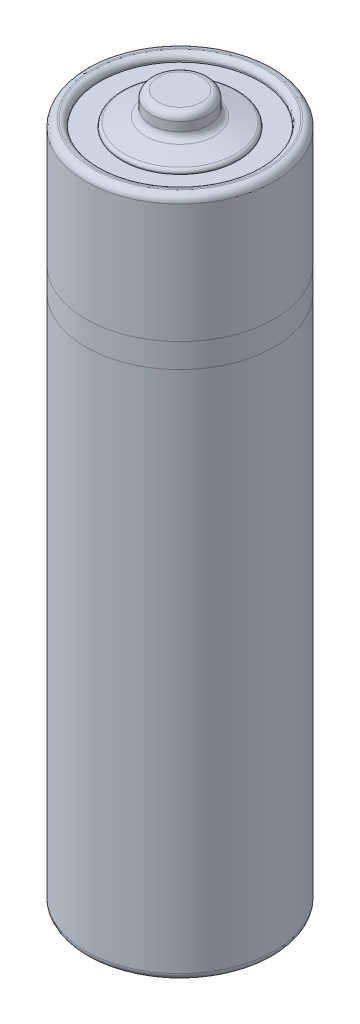
from build123d import *

# Parameters (mm, degrees)
FILLET1_R     = 0.5
FILLET2_R     = 0.4
FILLET3_R     = 0.25
FILLET4_R     = 0.5
FILLET5_R     = 0.5
FILLET6_R     = 0.5
FILLET7_R     = 0.3
CHAMFER1_SIZE = 0.5
CHAMFER2_SIZE = 1
CHAMFER3_SIZE = 0.25


# Some blends are built 0.0001 mm under size
with BuildPart() as part:
    # Sketch1 → Revolve1 (revolve)
    with BuildSketch(Plane.XY, mode=Mode.PRIVATE) as revolve1_sk:
        Polygon((0, -24.425), (0.75, -24.425), (0.75, -24.175), (1.5, -24.175), (1.5, -24.525), (4.5, -24.525), (4.5, -24.025), (5.5, -24.025), (5.5, -24.325), (6.5, -24.325), (6.5, 22.675), (5.5, 22.675), (5.5, 22.175), (4, 22.175), (4, 22.425), (2, 22.925), (2, 24.425), (0, 24.425), align=None)
    revolve(revolve1_sk.sketch.rotate(Axis((0, 54.317832455, 0), (0, -1, 0)), 90), axis=Axis((0, 54.317832455, 0), (0, -1, 0)))

    # Fillet1
    fillet1_edges = [part.edges().sort_by_distance(p)[0] for p in [
        (0, 22.675, -6.5),
    ]]
    fillet(fillet1_edges, radius=FILLET1_R)

    # Fillet2
    fillet2_edges = [part.edges().sort_by_distance(p)[0] for p in [
        (0, 22.675, -5.5),
    ]]
    fillet(fillet2_edges, radius=FILLET2_R)

    # Fillet3
    fillet3_edges = [part.edges().sort_by_distance(p)[0] for p in [
        (0, 22.425, -4),
    ]]
    fillet(fillet3_edges, radius=FILLET3_R)

    # Fillet4
    fillet4_edges = [part.edges().sort_by_distance(p)[0] for p in [
        (0, 22.925, -2),
    ]]
    fillet(fillet4_edges, radius=FILLET4_R)

    # Fillet5
    fillet5_edges = [part.edges().sort_by_distance(p)[0] for p in [
        (0, 24.425, -2),
    ]]
    fillet(fillet5_edges, radius=FILLET5_R)

    # Fillet6
    fillet6_edges = [part.edges().sort_by_distance(p)[0] for p in [
        (0, -24.325, -6.5),
    ]]
    fillet(fillet6_edges, radius=FILLET6_R)

    # Fillet7
    fillet7_edges = [part.edges().sort_by_distance(p)[0] for p in [
        (0, -24.325, -5.5),
    ]]
    fillet(fillet7_edges, radius=FILLET7_R - 0.0001)  # a hair under: the kernel refuses the full size

    # Chamfer1
    chamfer1_edges = [part.edges().sort_by_distance(p)[0] for p in [
        (0, -24.525, -4.5),
    ]]
    chamfer(chamfer1_edges, length=CHAMFER1_SIZE - 0.0001)  # a hair under: the kernel refuses the full size

    # Chamfer2
    # the kernel refuses this chamfer: 1 mm, written as the material it takes off along each edge
    with BuildSketch(Plane(origin=(0, -24.525, 0), x_dir=(0, 0, 1), z_dir=(1, 0, 0))) as chamfer2_piece_1_section:
        Polygon((1.5 + CHAMFER2_SIZE, 0), (1.5, -CHAMFER2_SIZE), (1.5, 0), align=None)
    chamfer2_piece_1 = revolve(axis=Axis((0, -24.525, 0), (0, -1, 0)), mode=Mode.PRIVATE)
    chamfer2_piece_1 = split(chamfer2_piece_1, bisect_by=Plane(origin=(0, -24.175, -2.328039708), z_dir=(0, -1, 0)), keep=Keep.TOP, mode=Mode.PRIVATE)
    add(chamfer2_piece_1, mode=Mode.SUBTRACT)

    # Chamfer3
    chamfer3_edges = [part.edges().sort_by_distance(p)[0] for p in [
        (0, -24.175, -0.75),
    ]]
    chamfer(chamfer3_edges, length=CHAMFER3_SIZE - 0.0001)  # a hair under: the kernel refuses the full size


solid = part.part
